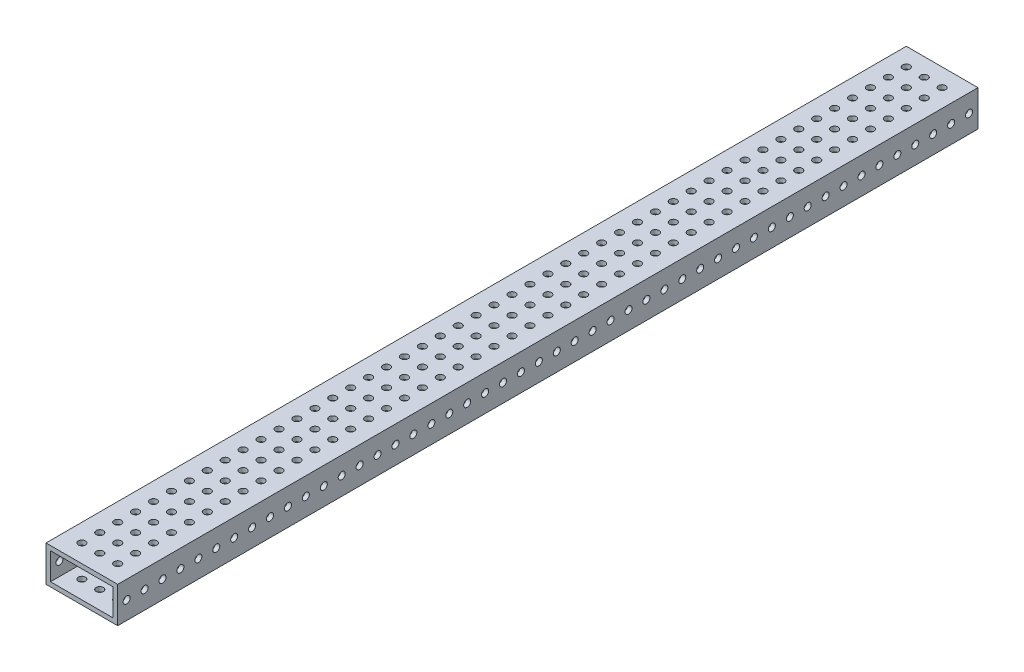
from build123d import *

# Parameters (mm, degrees)
SKETCH1_W           = 50.8
SKETCH1_H           = 25.4
SKETCH1_W_2         = 44.45
SKETCH1_H_2         = 19.05
BOSS_EXTRUDE1_DEPTH = 304.8
SKETCH2_R           = 2.5527
CUT_EXTRUDE1_DEPTH  = 307.909367729
SKETCH4_R           = 2.4892
CUT_EXTRUDE3_DEPTH  = 310.265209812


with BuildPart() as part:
    # Sketch1 → Boss-Extrude1 (new, symmetric)
    with BuildSketch(Plane.XY):
        Rectangle(SKETCH1_W, SKETCH1_H)
        Rectangle(SKETCH1_W_2, SKETCH1_H_2, mode=Mode.SUBTRACT)
    extrude(amount=BOSS_EXTRUDE1_DEPTH, both=True)

    # Sketch2 → Cut-Extrude1 (cut, through all)
    with BuildSketch(Plane(origin=(0, 12.7, 0), x_dir=(1, 0, 0), z_dir=(0, 1, 0))):
        with Locations((0, -292.1)):
            Circle(SKETCH2_R)
        with Locations((12.7, -292.1)):
            Circle(SKETCH2_R)
        with Locations((-12.7, -292.1)):
            Circle(SKETCH2_R)
        with Locations((-12.7, -279.4)):
            Circle(SKETCH2_R)
        with Locations((0, -279.4)):
            Circle(SKETCH2_R)
        with Locations((12.7, -279.4)):
            Circle(SKETCH2_R)
        with Locations((-12.7, -266.7)):
            Circle(SKETCH2_R)
        with Locations((0, -266.7)):
            Circle(SKETCH2_R)
        with Locations((12.7, -266.7)):
            Circle(SKETCH2_R)
        with Locations((-12.7, -254)):
            Circle(SKETCH2_R)
        with Locations((0, -254)):
            Circle(SKETCH2_R)
        with Locations((12.7, -254)):
            Circle(SKETCH2_R)
        with Locations((-12.7, -241.3)):
            Circle(SKETCH2_R)
        with Locations((0, -241.3)):
            Circle(SKETCH2_R)
        with Locations((12.7, -241.3)):
            Circle(SKETCH2_R)
        with Locations((-12.7, -228.6)):
            Circle(SKETCH2_R)
        with Locations((0, -228.6)):
            Circle(SKETCH2_R)
        with Locations((12.7, -228.6)):
            Circle(SKETCH2_R)
        with Locations((-12.7, -215.9)):
            Circle(SKETCH2_R)
        with Locations((0, -215.9)):
            Circle(SKETCH2_R)
        with Locations((12.7, -215.9)):
            Circle(SKETCH2_R)
        with Locations((-12.7, -203.2)):
            Circle(SKETCH2_R)
        with Locations((0, -203.2)):
            Circle(SKETCH2_R)
        with Locations((12.7, -203.2)):
            Circle(SKETCH2_R)
        with Locations((-12.7, -190.5)):
            Circle(SKETCH2_R)
        with Locations((0, -190.5)):
            Circle(SKETCH2_R)
        with Locations((12.7, -190.5)):
            Circle(SKETCH2_R)
        with Locations((-12.7, -177.8)):
            Circle(SKETCH2_R)
        with Locations((0, -177.8)):
            Circle(SKETCH2_R)
        with Locations((12.7, -177.8)):
            Circle(SKETCH2_R)
        with Locations((-12.7, -165.1)):
            Circle(SKETCH2_R)
        with Locations((0, -165.1)):
            Circle(SKETCH2_R)
        with Locations((12.7, -165.1)):
            Circle(SKETCH2_R)
        with Locations((-12.7, -152.4)):
            Circle(SKETCH2_R)
        with Locations((0, -152.4)):
            Circle(SKETCH2_R)
        with Locations((12.7, -152.4)):
            Circle(SKETCH2_R)
        with Locations((-12.7, -139.7)):
            Circle(SKETCH2_R)
        with Locations((0, -139.7)):
            Circle(SKETCH2_R)
        with Locations((12.7, -139.7)):
            Circle(SKETCH2_R)
        with Locations((-12.7, -127)):
            Circle(SKETCH2_R)
        with Locations((0, -127)):
            Circle(SKETCH2_R)
        with Locations((12.7, -127)):
            Circle(SKETCH2_R)
        with Locations((-12.7, -114.3)):
            Circle(SKETCH2_R)
        with Locations((0, -114.3)):
            Circle(SKETCH2_R)
        with Locations((12.7, -114.3)):
            Circle(SKETCH2_R)
        with Locations((-12.7, -101.6)):
            Circle(SKETCH2_R)
        with Locations((0, -101.6)):
            Circle(SKETCH2_R)
        with Locations((12.7, -101.6)):
            Circle(SKETCH2_R)
        with Locations((-12.7, -88.9)):
            Circle(SKETCH2_R)
        with Locations((0, -88.9)):
            Circle(SKETCH2_R)
        with Locations((12.7, -88.9)):
            Circle(SKETCH2_R)
        with Locations((-12.7, -76.2)):
            Circle(SKETCH2_R)
        with Locations((0, -76.2)):
            Circle(SKETCH2_R)
        with Locations((12.7, -76.2)):
            Circle(SKETCH2_R)
        with Locations((-12.7, -63.5)):
            Circle(SKETCH2_R)
        with Locations((0, -63.5)):
            Circle(SKETCH2_R)
        with Locations((12.7, -63.5)):
            Circle(SKETCH2_R)
        with Locations((-12.7, -50.8)):
            Circle(SKETCH2_R)
        with Locations((0, -50.8)):
            Circle(SKETCH2_R)
        with Locations((12.7, -50.8)):
            Circle(SKETCH2_R)
        with Locations((-12.7, -38.1)):
            Circle(SKETCH2_R)
        with Locations((0, -38.1)):
            Circle(SKETCH2_R)
        with Locations((12.7, -38.1)):
            Circle(SKETCH2_R)
        with Locations((-12.7, -25.4)):
            Circle(SKETCH2_R)
        with Locations((0, -25.4)):
            Circle(SKETCH2_R)
        with Locations((12.7, -25.4)):
            Circle(SKETCH2_R)
        with Locations((-12.7, -12.7)):
            Circle(SKETCH2_R)
        with Locations((0, -12.7)):
            Circle(SKETCH2_R)
        with Locations((12.7, -12.7)):
            Circle(SKETCH2_R)
        with Locations((-12.7, 0)):
            Circle(SKETCH2_R)
        Circle(SKETCH2_R)
        with Locations((12.7, 0)):
            Circle(SKETCH2_R)
        with Locations((-12.7, 12.7)):
            Circle(SKETCH2_R)
        with Locations((0, 12.7)):
            Circle(SKETCH2_R)
        with Locations((12.7, 12.7)):
            Circle(SKETCH2_R)
        with Locations((-12.7, 25.4)):
            Circle(SKETCH2_R)
        with Locations((0, 25.4)):
            Circle(SKETCH2_R)
        with Locations((12.7, 25.4)):
            Circle(SKETCH2_R)
        with Locations((-12.7, 38.1)):
            Circle(SKETCH2_R)
        with Locations((0, 38.1)):
            Circle(SKETCH2_R)
        with Locations((12.7, 38.1)):
            Circle(SKETCH2_R)
        with Locations((-12.7, 50.8)):
            Circle(SKETCH2_R)
        with Locations((0, 50.8)):
            Circle(SKETCH2_R)
        with Locations((12.7, 50.8)):
            Circle(SKETCH2_R)
        with Locations((-12.7, 63.5)):
            Circle(SKETCH2_R)
        with Locations((0, 63.5)):
            Circle(SKETCH2_R)
        with Locations((12.7, 63.5)):
            Circle(SKETCH2_R)
        with Locations((-12.7, 76.2)):
            Circle(SKETCH2_R)
        with Locations((0, 76.2)):
            Circle(SKETCH2_R)
        with Locations((12.7, 76.2)):
            Circle(SKETCH2_R)
        with Locations((-12.7, 88.9)):
            Circle(SKETCH2_R)
        with Locations((0, 88.9)):
            Circle(SKETCH2_R)
        with Locations((12.7, 88.9)):
            Circle(SKETCH2_R)
        with Locations((-12.7, 101.6)):
            Circle(SKETCH2_R)
        with Locations((0, 101.6)):
            Circle(SKETCH2_R)
        with Locations((12.7, 101.6)):
            Circle(SKETCH2_R)
        with Locations((-12.7, 114.3)):
            Circle(SKETCH2_R)
        with Locations((0, 114.3)):
            Circle(SKETCH2_R)
        with Locations((12.7, 114.3)):
            Circle(SKETCH2_R)
        with Locations((-12.7, 127)):
            Circle(SKETCH2_R)
        with Locations((0, 127)):
            Circle(SKETCH2_R)
        with Locations((12.7, 127)):
            Circle(SKETCH2_R)
        with Locations((12.7, 139.7)):
            Circle(SKETCH2_R)
        with Locations((0, 139.7)):
            Circle(SKETCH2_R)
        with Locations((-12.7, 139.7)):
            Circle(SKETCH2_R)
        with Locations((12.7, 152.4)):
            Circle(SKETCH2_R)
        with Locations((0, 152.4)):
            Circle(SKETCH2_R)
        with Locations((-12.7, 152.4)):
            Circle(SKETCH2_R)
        with Locations((12.7, 165.1)):
            Circle(SKETCH2_R)
        with Locations((0, 165.1)):
            Circle(SKETCH2_R)
        with Locations((-12.7, 165.1)):
            Circle(SKETCH2_R)
        with Locations((12.7, 177.8)):
            Circle(SKETCH2_R)
        with Locations((0, 177.8)):
            Circle(SKETCH2_R)
        with Locations((-12.7, 177.8)):
            Circle(SKETCH2_R)
        with Locations((12.7, 190.5)):
            Circle(SKETCH2_R)
        with Locations((0, 190.5)):
            Circle(SKETCH2_R)
        with Locations((-12.7, 190.5)):
            Circle(SKETCH2_R)
        with Locations((12.7, 203.2)):
            Circle(SKETCH2_R)
        with Locations((0, 203.2)):
            Circle(SKETCH2_R)
        with Locations((-12.7, 203.2)):
            Circle(SKETCH2_R)
        with Locations((12.7, 215.9)):
            Circle(SKETCH2_R)
        with Locations((0, 215.9)):
            Circle(SKETCH2_R)
        with Locations((-12.7, 215.9)):
            Circle(SKETCH2_R)
        with Locations((12.7, 228.6)):
            Circle(SKETCH2_R)
        with Locations((0, 228.6)):
            Circle(SKETCH2_R)
        with Locations((-12.7, 228.6)):
            Circle(SKETCH2_R)
        with Locations((12.7, 241.3)):
            Circle(SKETCH2_R)
        with Locations((0, 241.3)):
            Circle(SKETCH2_R)
        with Locations((-12.7, 241.3)):
            Circle(SKETCH2_R)
        with Locations((12.7, 254)):
            Circle(SKETCH2_R)
        with Locations((0, 254)):
            Circle(SKETCH2_R)
        with Locations((-12.7, 254)):
            Circle(SKETCH2_R)
        with Locations((12.7, 266.7)):
            Circle(SKETCH2_R)
        with Locations((0, 266.7)):
            Circle(SKETCH2_R)
        with Locations((-12.7, 266.7)):
            Circle(SKETCH2_R)
        with Locations((12.7, 279.4)):
            Circle(SKETCH2_R)
        with Locations((0, 279.4)):
            Circle(SKETCH2_R)
        with Locations((-12.7, 279.4)):
            Circle(SKETCH2_R)
        with Locations((12.7, 292.1)):
            Circle(SKETCH2_R)
        with Locations((0, 292.1)):
            Circle(SKETCH2_R)
        with Locations((-12.7, 292.1)):
            Circle(SKETCH2_R)
    extrude(amount=-CUT_EXTRUDE1_DEPTH, mode=Mode.SUBTRACT)

    # Sketch4 → Cut-Extrude3 (cut, through all)
    with BuildSketch(Plane(origin=(25.4, 0, 0), x_dir=(0, 0, -1), z_dir=(1, 0, 0))):
        with Locations((-298.45, 0)):
            Circle(SKETCH4_R)
        with Locations((-285.75, 0)):
            Circle(SKETCH4_R)
        with Locations((-273.05, 0)):
            Circle(SKETCH4_R)
        with Locations((-260.35, 0)):
            Circle(SKETCH4_R)
        with Locations((-247.65, 0)):
            Circle(SKETCH4_R)
        with Locations((133.35, 0)):
            Circle(SKETCH4_R)
        with Locations((146.05, 0)):
            Circle(SKETCH4_R)
        with Locations((158.75, 0)):
            Circle(SKETCH4_R)
        with Locations((171.45, 0)):
            Circle(SKETCH4_R)
        with Locations((184.15, 0)):
            Circle(SKETCH4_R)
        with Locations((196.85, 0)):
            Circle(SKETCH4_R)
        with Locations((209.55, 0)):
            Circle(SKETCH4_R)
        with Locations((222.25, 0)):
            Circle(SKETCH4_R)
        with Locations((234.95, 0)):
            Circle(SKETCH4_R)
        with Locations((247.65, 0)):
            Circle(SKETCH4_R)
        with Locations((260.35, 0)):
            Circle(SKETCH4_R)
        with Locations((273.05, 0)):
            Circle(SKETCH4_R)
        with Locations((285.75, 0)):
            Circle(SKETCH4_R)
        with Locations((298.45, 0)):
            Circle(SKETCH4_R)
        with Locations((-234.95, 0)):
            Circle(SKETCH4_R)
        with Locations((-222.25, 0)):
            Circle(SKETCH4_R)
        with Locations((-209.55, 0)):
            Circle(SKETCH4_R)
        with Locations((-196.85, 0)):
            Circle(SKETCH4_R)
        with Locations((-184.15, 0)):
            Circle(SKETCH4_R)
        with Locations((-171.45, 0)):
            Circle(SKETCH4_R)
        with Locations((-158.75, 0)):
            Circle(SKETCH4_R)
        with Locations((-146.05, 0)):
            Circle(SKETCH4_R)
        with Locations((-133.35, 0)):
            Circle(SKETCH4_R)
        with Locations((-120.65, 0)):
            Circle(SKETCH4_R)
        with Locations((-107.95, 0)):
            Circle(SKETCH4_R)
        with Locations((-95.25, 0)):
            Circle(SKETCH4_R)
        with Locations((-82.55, 0)):
            Circle(SKETCH4_R)
        with Locations((-69.85, 0)):
            Circle(SKETCH4_R)
        with Locations((-57.15, 0)):
            Circle(SKETCH4_R)
        with Locations((-44.45, 0)):
            Circle(SKETCH4_R)
        with Locations((-31.75, 0)):
            Circle(SKETCH4_R)
        with Locations((-19.05, 0)):
            Circle(SKETCH4_R)
        with Locations((-6.35, 0)):
            Circle(SKETCH4_R)
        with Locations((6.35, 0)):
            Circle(SKETCH4_R)
        with Locations((19.05, 0)):
            Circle(SKETCH4_R)
        with Locations((31.75, 0)):
            Circle(SKETCH4_R)
        with Locations((44.45, 0)):
            Circle(SKETCH4_R)
        with Locations((57.15, 0)):
            Circle(SKETCH4_R)
        with Locations((69.85, 0)):
            Circle(SKETCH4_R)
        with Locations((82.55, 0)):
            Circle(SKETCH4_R)
        with Locations((95.25, 0)):
            Circle(SKETCH4_R)
        with Locations((107.95, 0)):
            Circle(SKETCH4_R)
        with Locations((120.65, 0)):
            Circle(SKETCH4_R)
    extrude(amount=-CUT_EXTRUDE3_DEPTH, mode=Mode.SUBTRACT)


solid = part.part
